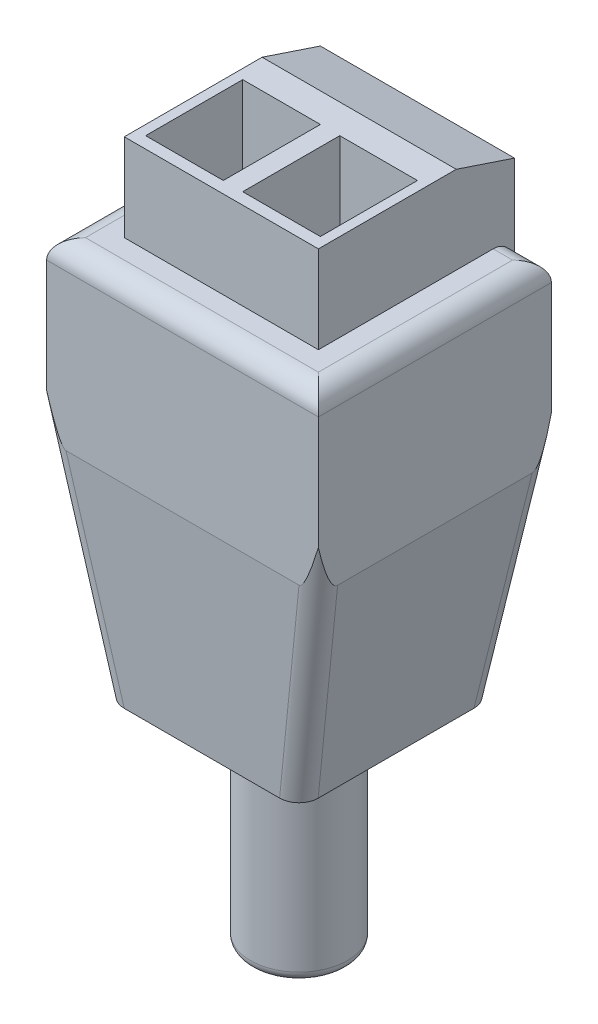
from build123d import *

# Parameters (mm, degrees)
SKETCH_1_W          = 14
SKETCH_1_H          = 12
EXTRUDE_1_DEPTH     = 9
FILLET_2_R          = 1
FILLET_3_R          = 1
SKETCH_6_R          = 2.5
EXTRUDE_2_DEPTH     = 11
FILLET_4_R          = 0.5
SKETCH_7_R          = 2
CUT_EXTRUDE_1_DEPTH = 0.5
FILLET_5_R          = 0.5
SKETCH_8_W          = 10
SKETCH_8_H          = 5.607572988
CUT_EXTRUDE_2_DEPTH = 10
SKETCH_9_W          = 10
SKETCH_9_H          = 6
EXTRUDE_3_DEPTH     = 10.1
SKETCH_10_R         = 1.75
CUT_EXTRUDE_3_DEPTH = 0.5
CUT_EXTRUDE_4_DEPTH = 28.828223084
SKETCH_12_W         = 4
SKETCH_12_H         = 5
CUT_EXTRUDE_5_DEPTH = 5


# Some blends are built 0.0001 mm under size
with BuildPart() as part:
    # 草图1 → 凸台-拉伸1 (new body)
    with BuildSketch(Plane(origin=(0, 0, 0), x_dir=(1, 0, 0), z_dir=(0, 1, 0))):
        with Locations((7, 6)):
            Rectangle(SKETCH_1_W, SKETCH_1_H)
    extrude(amount=EXTRUDE_1_DEPTH)

    # 圆角2
    fillet_2_edges = [part.edges().sort_by_distance(p)[0] for p in [
        (14, 9, -6),
        (7, 9, -12),
        (0, 9, -6),
        (7, 9, 0),
    ]]
    fillet(fillet_2_edges, radius=FILLET_2_R)

    # 草图4 → 放样1 section 0
    with BuildSketch(Plane.XZ):
        with BuildLine():
            Line((0, 0), (14, 0))
            Line((14, 0), (14, -12))
            Line((14, -12), (0, -12))
            Line((0, -12), (0, 0))
        make_face()
    # 草图5 → 放样1 section 1
    with BuildSketch(Plane(origin=(0, -11, 0), x_dir=(-1, 0, 0), z_dir=(0, -1, 0))):
        with BuildLine():
            Line((-2, 1), (-12, 1))
            Line((-12, 1), (-12, 11))
            Line((-12, 11), (-2, 11))
            Line((-2, 11), (-2, 1))
        make_face()
    loft()

    # 圆角3
    # the kernel refuses this fillet: 1 mm, written as the material it takes off along each edge
    with BuildSketch(Plane(origin=(14.438278825, 2.410533539, -12.219139413), x_dir=(0.015936381457793344, 0.08765009801785527, 0.9960238411119947), z_dir=(-0.1781741612749496, -0.9799578870122228, 0.0890870806374748)), Plane(origin=(14.438278825, 2.410533539, 0.219139413), x_dir=(-0.9839989676081822, 0.17744243678180333, 0.016131130616527562), z_dir=(-0.1781741612749496, -0.9799578870122228, -0.08908708063747467))) as fillet_3_piece_1:
        with BuildLine():
            CenterArc((FILLET_3_R * 0.983933522321, FILLET_3_R), FILLET_3_R, 180.927975892, 89.072024108)
            Line((-FILLET_3_R * 0.0159353215369, FILLET_3_R * 0.983804473396), (0, 0))
            Line((0, 0), (FILLET_3_R * 0.983933522321, 0))
        make_face()
    extrude(amount=16.144639772, mode=Mode.SUBTRACT)
    with BuildSketch(Plane(origin=(-0.438278825, 2.410533539, -12.219139413), x_dir=(-0.015936381457791863, 0.08765009801785537, 0.9960238411119947), z_dir=(0.1781741612749496, -0.9799578870122228, 0.08908708063747463)), Plane(origin=(-0.438278825, 2.410533539, 0.219139413), x_dir=(0.9839989676081822, 0.17744243678180333, 0.016131130616527607), z_dir=(0.1781741612749496, -0.9799578870122228, -0.0890870806374748))) as fillet_3_piece_2:
        with BuildLine():
            CenterArc((FILLET_3_R * 0.983933522321, -FILLET_3_R), FILLET_3_R, 90, 89.072024108)
            Line((-FILLET_3_R * 0.0159353215369, -FILLET_3_R * 0.983804473396), (0, 0))
            Line((0, 0), (FILLET_3_R * 0.983933522321, 0))
        make_face()
    extrude(amount=16.144639772, mode=Mode.SUBTRACT)

    # 草图6 → 凸台-拉伸2 (add)
    with BuildSketch(Plane.XZ.offset(11)):
        with Locations(Location((7, -6, 0), (0, 0, 270))):
            Circle(SKETCH_6_R)
    extrude(amount=EXTRUDE_2_DEPTH)

    # 圆角4
    fillet_4_edges = [part.edges().sort_by_distance(p)[0] for p in [
        (7, -22, -3.5),
    ]]
    fillet(fillet_4_edges, radius=FILLET_4_R)

    # 草图7 → 切除-拉伸1 (cut)
    with BuildSketch(Plane.XZ.offset(22)):
        with Locations(Location((7, -6, 0), (0, 0, 270))):
            Circle(SKETCH_7_R)
    extrude(amount=-CUT_EXTRUDE_1_DEPTH, mode=Mode.SUBTRACT)

    # 圆角5
    fillet_5_edges = [part.edges().sort_by_distance(p)[0] for p in [
        (7, -21.5, -4),
    ]]
    fillet(fillet_5_edges, radius=FILLET_5_R - 0.0001)  # a hair under: the kernel refuses the full size

    # 草图8 → 切除-拉伸2 (cut)
    with BuildSketch(Plane(origin=(0, 0, -12), x_dir=(-1, 0, 0), z_dir=(0, 0, -1))):
        with Locations((-7, 10.303786494)):
            Rectangle(SKETCH_8_W, SKETCH_8_H)
    extrude(amount=-CUT_EXTRUDE_2_DEPTH, mode=Mode.SUBTRACT)

    # 草图9 → 凸台-拉伸3 (add)
    with BuildSketch(Plane(origin=(0, 0, -2), x_dir=(-1, 0, 0), z_dir=(0, 0, -1))):
        with Locations((-7, 10.5)):
            Rectangle(SKETCH_9_W, SKETCH_9_H)
    extrude(amount=EXTRUDE_3_DEPTH)

    # 草图10 → 切除-拉伸3 (cut)
    with BuildSketch(Plane(origin=(0, 0, -12.1), x_dir=(-1, 0, 0), z_dir=(0, 0, -1))):
        with Locations((-4.5, 10)):
            Circle(SKETCH_10_R)
        with Locations((-9.5, 10)):
            Circle(SKETCH_10_R)
    extrude(amount=-CUT_EXTRUDE_3_DEPTH, mode=Mode.SUBTRACT)

    # 草图11 → 切除-拉伸4 (cut, through all)
    with BuildSketch(Plane.ZY.offset(-2)):
        Polygon((-12.1, 12.5), (-12.1, 13.5), (-9.1, 13.5), align=None)
    extrude(amount=-CUT_EXTRUDE_4_DEPTH, mode=Mode.SUBTRACT)

    # 草图12 → 切除-拉伸5 (cut)
    with BuildSketch(Plane(origin=(0, 13.5, 0), x_dir=(1, 0, 0), z_dir=(0, 1, 0))):
        with Locations((4.5, 5.1)):
            Rectangle(SKETCH_12_W, SKETCH_12_H)
        with Locations((9.5, 5.1)):
            Rectangle(SKETCH_12_W, SKETCH_12_H)
    extrude(amount=-CUT_EXTRUDE_5_DEPTH, mode=Mode.SUBTRACT)


solid = part.part
